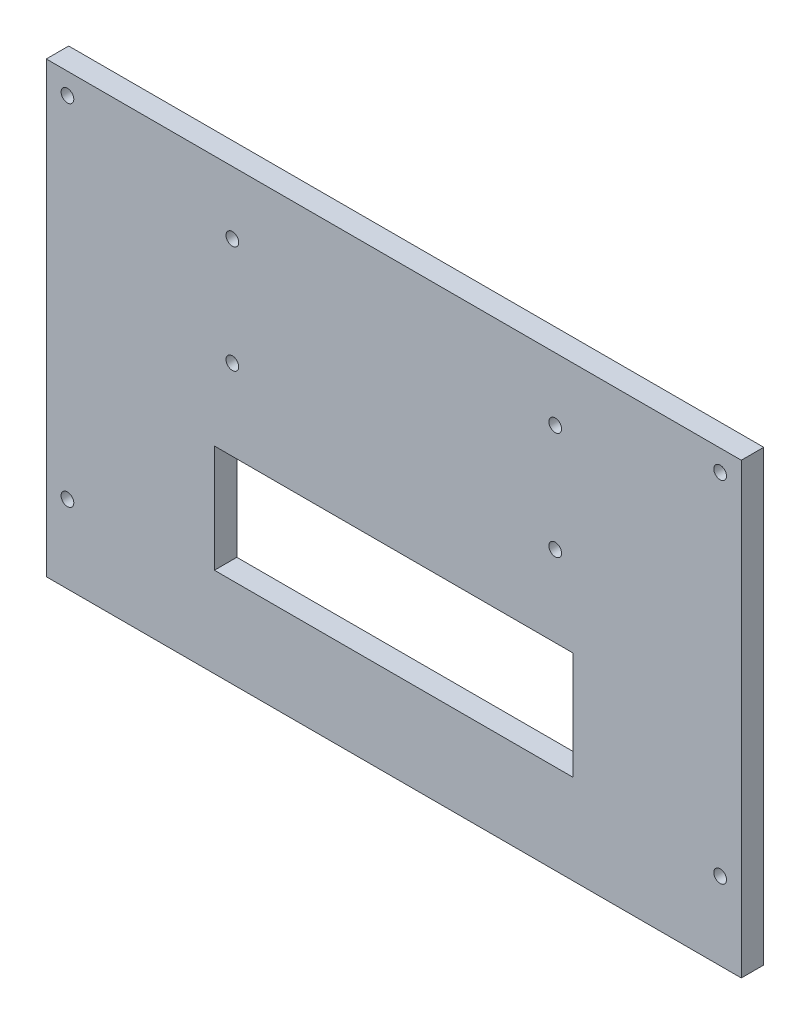
from build123d import *

# Parameters (mm, degrees)
SKETCH1_W            = 196.85
SKETCH1_H            = 127
BOSS_EXTRUDE1_DEPTH  = 6.35
M3_CLEARANCE_HOLE1_D = 3.6
SKETCH7_W            = 101.6
SKETCH7_H            = 30.48
TUBINGSLOT_DEPTH     = 235.348554508
M3_CLEARANCE_HOLE2_D = 3.6


with BuildPart() as part:
    # Sketch1 → Boss-Extrude1 (new body)
    with BuildSketch(Plane.XY):
        with Locations((98.425, 63.5)):
            Rectangle(SKETCH1_W, SKETCH1_H)
    extrude(amount=BOSS_EXTRUDE1_DEPTH)

    # M3 Clearance Hole1 (through all)
    with Locations(Plane.XY.offset(6.35)):
        with Locations((5.9944, 121.0056), (5.9944, 21.9964), (190.8556, 21.9964), (190.8556, 121.0056)):
            Hole(M3_CLEARANCE_HOLE1_D / 2)

    # Sketch7 → tubingslot (cut, through all)
    with BuildSketch(Plane.XY.offset(6.35)):
        with Locations((98.425, 40.64)):
            Rectangle(SKETCH7_W, SKETCH7_H)
    extrude(amount=-TUBINGSLOT_DEPTH, mode=Mode.SUBTRACT)

    # M3 Clearance Hole2 (through all)
    with Locations(Plane.XY.offset(6.35)):
        with Locations((52.705, 109.22), (144.145, 109.22), (52.705, 78.74), (144.145, 78.74)):
            Hole(M3_CLEARANCE_HOLE2_D / 2)


solid = part.part
